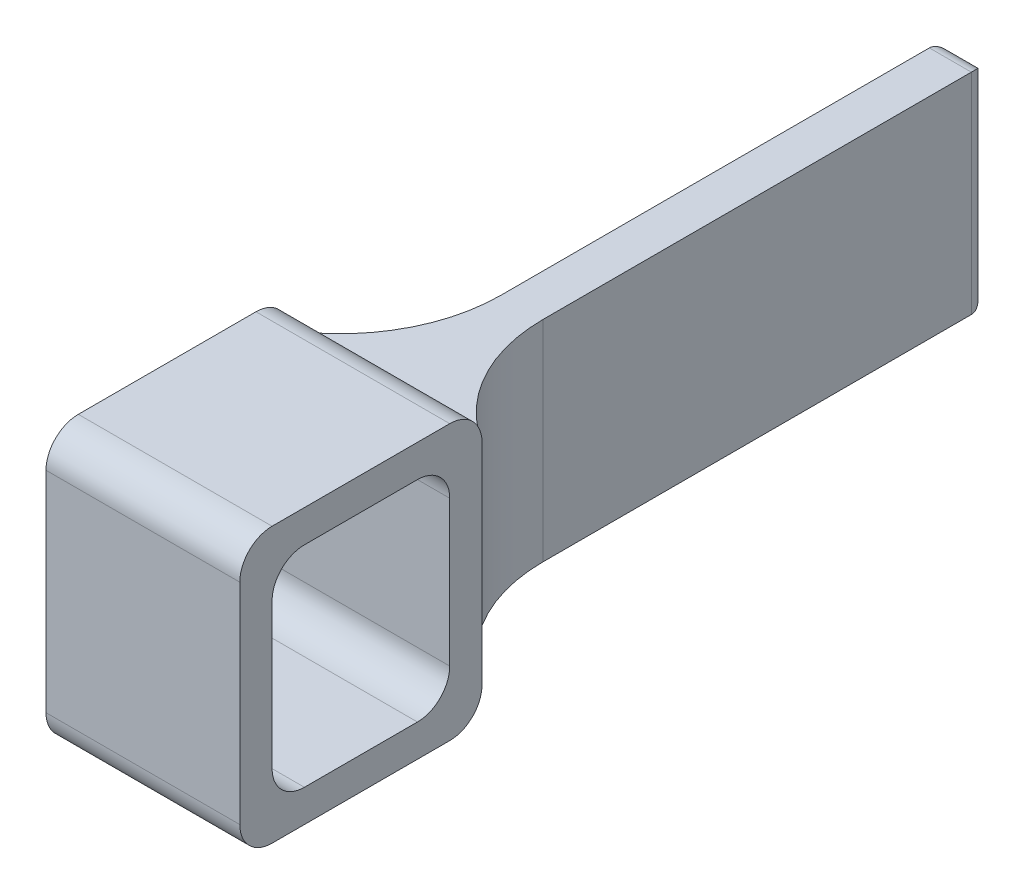
from build123d import *

# Parameters (mm, degrees)
RESSALTO_EXTRUS_O1_DEPTH = 6
CORTE_EXTRUS_O1_DEPTH    = 389.589061789
ESBO_O3_W                = 1.3
ESBO_O3_H                = 6.5
RESSALTO_EXTRUS_O2_DEPTH = 18
FILETE1_R                = 5
FILETE3_R                = 0.5


with BuildPart() as part:
    # Esboço1 → Ressalto-extrusão1 (new body)
    with BuildSketch(Plane(origin=(-161.802837797, 0, 0), x_dir=(0, 0, -1), z_dir=(1, 0, 0))):
        with BuildLine():
            Line((384.694639655, 46.958533656), (379.194639655, 46.958533656))
            ThreePointArc((379.194639655, 46.958533656), (378.487532874, 46.665640437), (378.194639655, 45.958533656))
            Line((378.194639655, 45.958533656), (378.194639655, 39.458533656))
            ThreePointArc((378.194639655, 39.458533656), (378.487532874, 38.751426875), (379.194639655, 38.458533656))
            Line((379.194639655, 38.458533656), (384.694639655, 38.458533656))
            ThreePointArc((384.694639655, 38.458533656), (385.401746437, 38.751426875), (385.694639655, 39.458533656))
            Line((385.694639655, 39.458533656), (385.694639655, 45.958533656))
            ThreePointArc((385.694639655, 45.958533656), (385.401746437, 46.665640437), (384.694639655, 46.958533656))
        make_face()
    extrude(amount=RESSALTO_EXTRUS_O1_DEPTH)

    # Esboço2 → Corte-extrusão1 (cut, through all)
    with BuildSketch(Plane(origin=(-155.802837797, 0, 0), x_dir=(0, 0, -1), z_dir=(1, 0, 0))):
        with BuildLine():
            Line((380.194639655, 45.958533656), (383.694639655, 45.958533656))
            ThreePointArc((383.694639655, 45.958533656), (384.401746437, 45.665640437), (384.694639655, 44.958533656))
            Line((384.694639655, 44.958533656), (384.694639655, 40.458533656))
            ThreePointArc((384.694639655, 40.458533656), (384.401746437, 39.751426875), (383.694639655, 39.458533656))
            Line((383.694639655, 39.458533656), (380.194639655, 39.458533656))
            ThreePointArc((380.194639655, 39.458533656), (379.487532874, 39.751426875), (379.194639655, 40.458533656))
            Line((379.194639655, 40.458533656), (379.194639655, 44.958533656))
            ThreePointArc((379.194639655, 44.958533656), (379.487532874, 45.665640437), (380.194639655, 45.958533656))
        make_face()
    extrude(amount=-CORTE_EXTRUS_O1_DEPTH, mode=Mode.SUBTRACT)

    # Esboço3 → Ressalto-extrusão2 (add)
    with BuildSketch(Plane(origin=(0, 0, -385.694639655), x_dir=(-1, 0, 0), z_dir=(0, 0, -1))):
        with Locations((158.802837797, 42.708533656)):
            Rectangle(ESBO_O3_W, ESBO_O3_H)
    extrude(amount=RESSALTO_EXTRUS_O2_DEPTH)

    # Filete1
    # the kernel refuses this fillet: 5 mm, written as the material it adds along each edge
    with BuildSketch(Plane(origin=(-159.452837797, 39.458533656, -385.694639655), x_dir=(-1, 0, 0), z_dir=(0, 1, 0)), Plane(origin=(-158.152837797, 45.958533656, -385.694639655), x_dir=(1, 0, 0), z_dir=(0, -1, 0))) as filete1_piece_1:
        with BuildLine():
            CenterArc((5, -4.239988208), FILETE1_R, 122.005454828, 57.994545172)
            Line((0, -4.239988208), (-0.1, -4.239988208))
            Line((-0.1, -4.239988208), (-0.1, 0))
            Line((-0.1, 0), (0, 0.1))
            ThreePointArc((0, 0.1), (1.175, 0.1), (2.297, 0.084799764))
            Line((2.297, 0.084799764), (2.35, 0))
        make_face()
    extrude(amount=6.5)

    # Filete3
    filete3_edges = [part.edges().sort_by_distance(p)[0] for p in [
        (-159.452837797, 42.708533656, -403.694639655),
        (-158.802837797, 45.958533656, -403.694639655),
        (-158.152837797, 42.708533656, -403.694639655),
        (-158.802837797, 39.458533656, -403.694639655),
    ]]
    fillet(filete3_edges, radius=FILETE3_R)


solid = part.part
